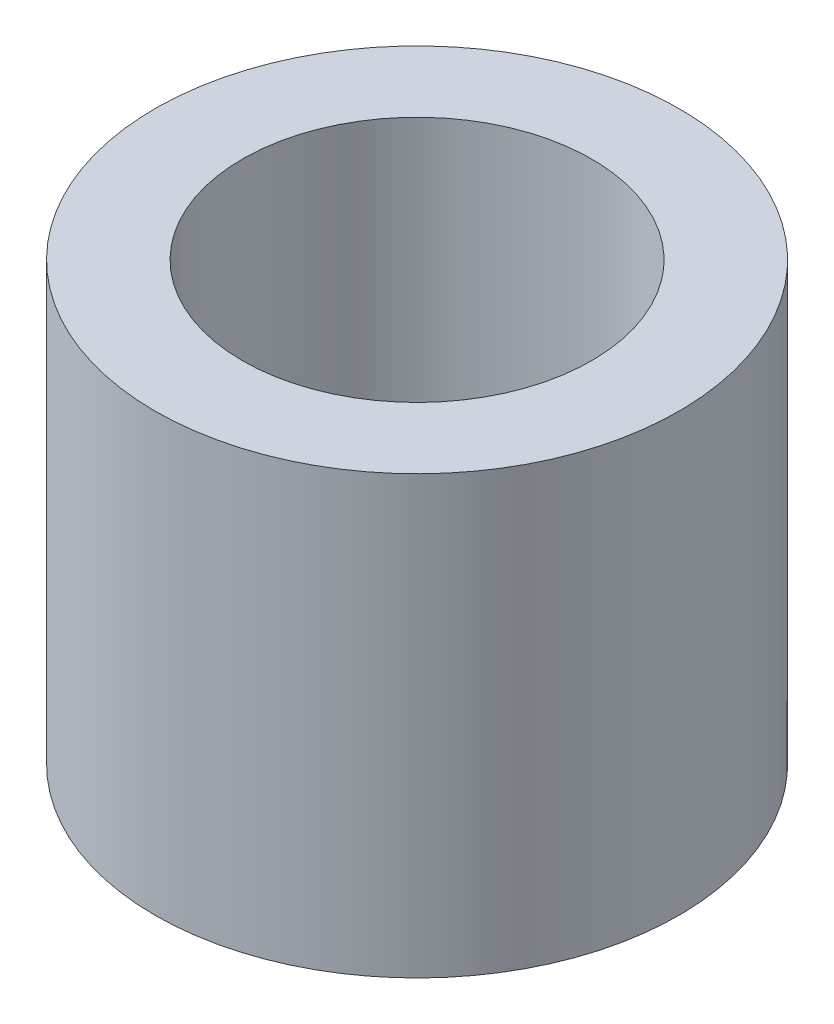
from build123d import *

# Parameters (mm, degrees)
SKETCH_1_R      = 3
SKETCH_1_R_2    = 2
EXTRUDE_1_DEPTH = 5


with BuildPart() as part:
    # 草图1 → 凸台-拉伸1 (new body)
    with BuildSketch(Plane(origin=(0, 0, 0), x_dir=(1, 0, 0), z_dir=(0, 1, 0))):
        Circle(SKETCH_1_R)
        Circle(SKETCH_1_R_2, mode=Mode.SUBTRACT)
    extrude(amount=EXTRUDE_1_DEPTH)


solid = part.part
